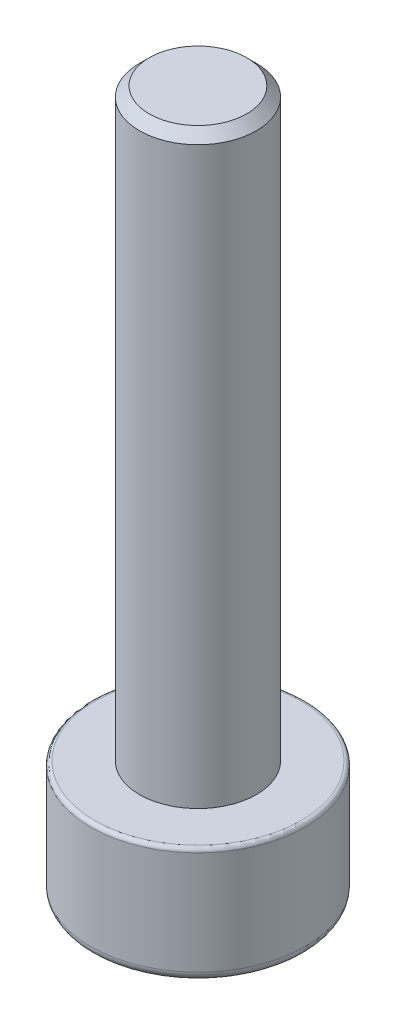
from build123d import *

# Parameters (mm, degrees)
SKETCH1_R           = 2.75
BOSS_EXTRUDE1_DEPTH = 3
SKETCH2_R           = 1.5
BOSS_EXTRUDE2_DEPTH = 15
CUT_EXTRUDE1_DEPTH  = 1.5
CHAMFER1_SIZE       = 0.25
FILLET1_R           = 0.25
CHAMFER2_SIZE       = 0.25
FILLET2_R           = 0.1


with BuildPart() as part:
    # Sketch1 → Boss-Extrude1 (new body)
    with BuildSketch(Plane(origin=(0, 0, 0), x_dir=(1, 0, 0), z_dir=(0, 1, 0))):
        Circle(SKETCH1_R)
    extrude(amount=BOSS_EXTRUDE1_DEPTH)

    # Sketch2 → Boss-Extrude2 (add)
    with BuildSketch(Plane(origin=(0, 3, 0), x_dir=(1, 0, 0), z_dir=(0, 1, 0))):
        Circle(SKETCH2_R)
    extrude(amount=BOSS_EXTRUDE2_DEPTH)

    # Sketch3 → Cut-Extrude1 (cut)
    with BuildSketch(Plane.XZ):
        Polygon((0.934168857, 0.974591477), (-0.376936549, 1.2963097), (-1.311105406, 0.321718223), (-0.934168857, -0.974591477), (0.376936549, -1.2963097), (1.311105406, -0.321718223), align=None)
    extrude(amount=-CUT_EXTRUDE1_DEPTH, mode=Mode.SUBTRACT)

    # Chamfer1
    chamfer1_edges = [part.edges().sort_by_distance(p)[0] for p in [
        (-0.278616154, 0, -1.135450588),
        (-1.122637131, 0, -0.326436627),
        (-0.844020977, 0, 0.809013962),
        (0.278616154, 0, 1.135450588),
        (1.122637131, 0, 0.326436627),
        (0.844020977, 0, -0.809013962),
    ]]
    chamfer(chamfer1_edges, length=CHAMFER1_SIZE)

    # Fillet1
    fillet1_edges = [part.edges().sort_by_distance(p)[0] for p in [
        (-2.75, 0, 0),
    ]]
    fillet(fillet1_edges, radius=FILLET1_R)

    # Chamfer2
    chamfer2_edges = [part.edges().sort_by_distance(p)[0] for p in [
        (-1.5, 18, 0),
    ]]
    chamfer(chamfer2_edges, length=CHAMFER2_SIZE)

    # Fillet2
    fillet2_edges = [part.edges().sort_by_distance(p)[0] for p in [
        (-2.75, 3, 0),
    ]]
    fillet(fillet2_edges, radius=FILLET2_R)


solid = part.part
